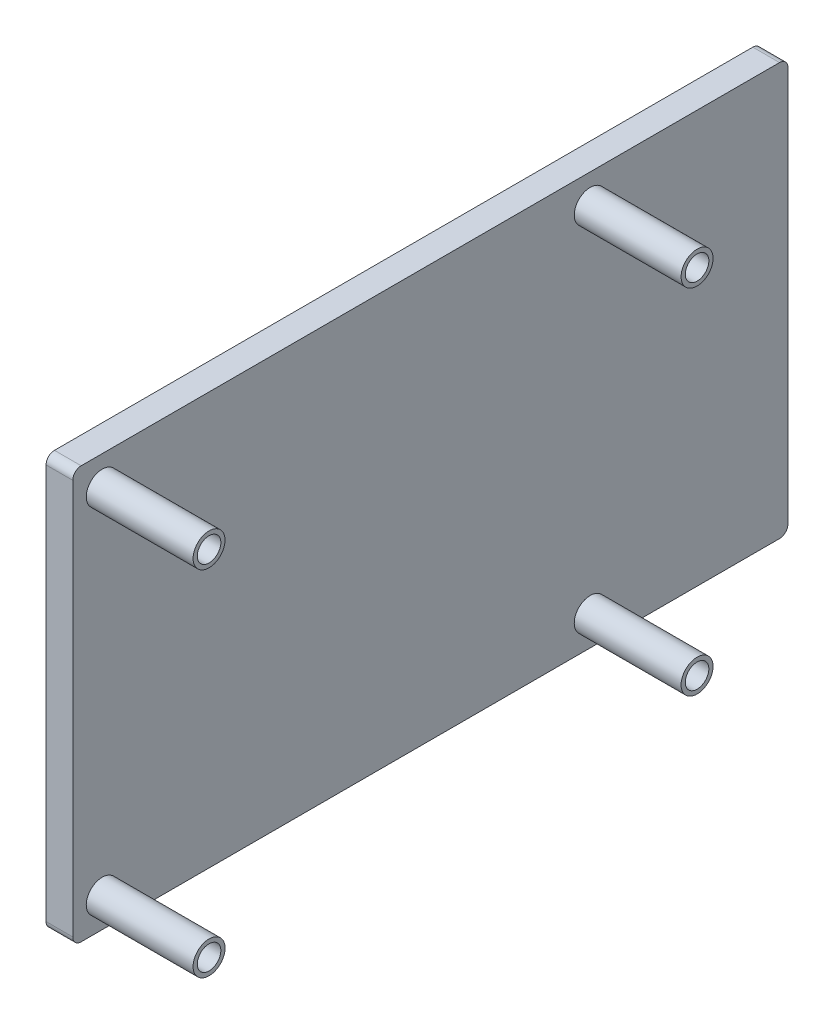
from build123d import *

# Parameters (mm, degrees)
SKETCH1_W           = 85
SKETCH1_H           = 49
BOSS_EXTRUDE1_DEPTH = 3.175
SKETCH2_R           = 1.9
SKETCH2_R_2         = 1.4
BOSS_EXTRUDE2_DEPTH = 12.7
FILLET1_R           = 1


with BuildPart() as part:
    # Sketch1 → Boss-Extrude1 (new body)
    with BuildSketch(Plane(origin=(0, 0, 0), x_dir=(0, 0, -1), z_dir=(1, 0, 0))):
        with Locations((-11.829824561, -9.198245614)):
            Rectangle(SKETCH1_W, SKETCH1_H)
    extrude(amount=BOSS_EXTRUDE1_DEPTH)

    # Sketch2 → Boss-Extrude2 (add)
    # profile 1 of 4: a face of its own
    with BuildSketch(Plane(origin=(3.175, 0, 0), x_dir=(0, 0, -1), z_dir=(1, 0, 0))):
        with Locations((-50.829824561, 11.801754386)):
            Circle(SKETCH2_R)
        with Locations((-50.829824561, 11.801754386)):
            Circle(SKETCH2_R_2, mode=Mode.SUBTRACT)
    # profile 2 of 4: a face of its own
    with BuildSketch(Plane(origin=(3.175, 0, 0), x_dir=(0, 0, -1), z_dir=(1, 0, 0))):
        with Locations((7.170175439, 11.801754386)):
            Circle(SKETCH2_R)
        with Locations((7.170175439, 11.801754386)):
            Circle(SKETCH2_R_2, mode=Mode.SUBTRACT)
    # profile 3 of 4: a face of its own
    with BuildSketch(Plane(origin=(3.175, 0, 0), x_dir=(0, 0, -1), z_dir=(1, 0, 0))):
        with Locations((7.170175439, -30.198245614)):
            Circle(SKETCH2_R)
        with Locations((7.170175439, -30.198245614)):
            Circle(SKETCH2_R_2, mode=Mode.SUBTRACT)
    # profile 4 of 4: a face of its own
    with BuildSketch(Plane(origin=(3.175, 0, 0), x_dir=(0, 0, -1), z_dir=(1, 0, 0))):
        with Locations((-50.829824561, -30.198245614)):
            Circle(SKETCH2_R)
        with Locations((-50.829824561, -30.198245614)):
            Circle(SKETCH2_R_2, mode=Mode.SUBTRACT)
    extrude(amount=BOSS_EXTRUDE2_DEPTH)

    # Fillet1
    fillet1_edges = [part.edges().sort_by_distance(p)[0] for p in [
        (1.5875, 15.301754386, 54.329824561),
        (1.5875, 15.301754386, -30.670175439),
        (1.5875, -33.698245614, -30.670175439),
        (1.5875, -33.698245614, 54.329824561),
    ]]
    fillet(fillet1_edges, radius=FILLET1_R)


solid = part.part
